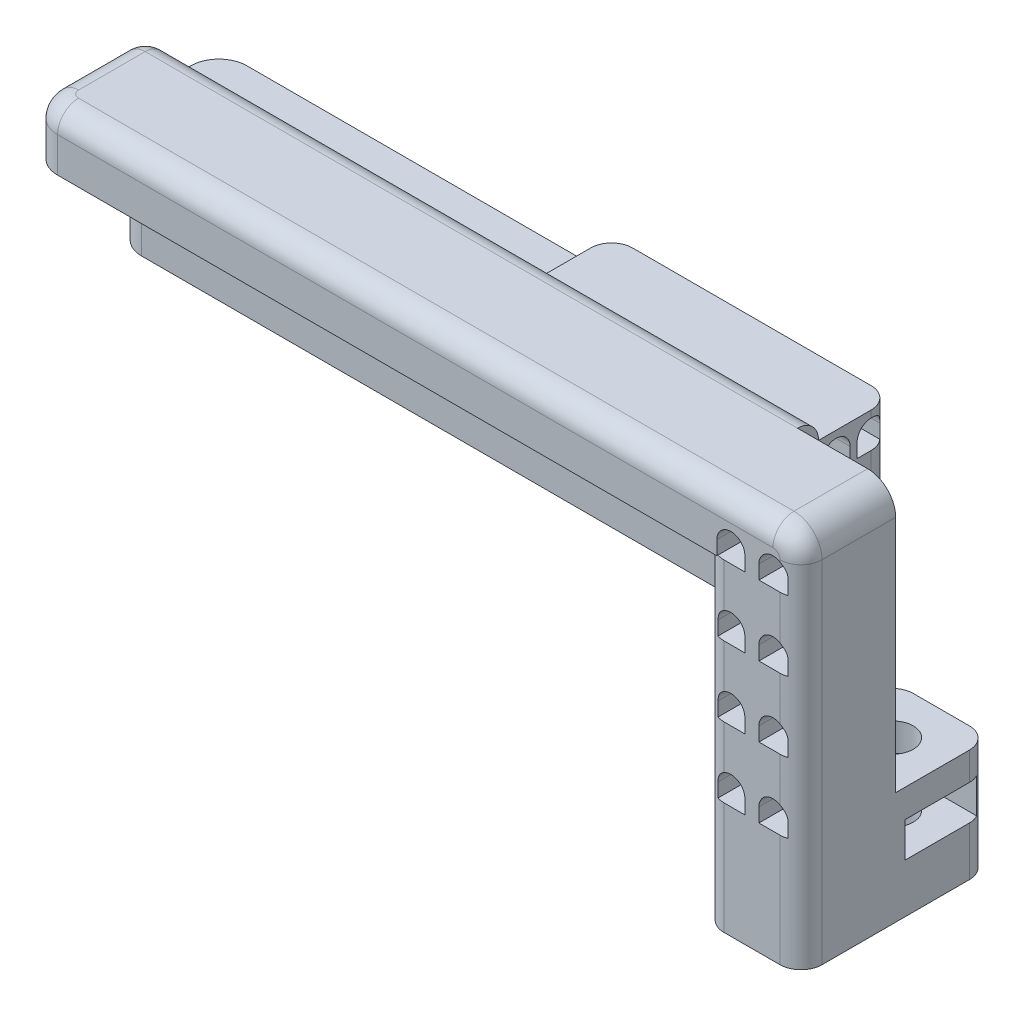
from build123d import *

# Parameters (mm, degrees)
SKETCH1_W            = 55
SKETCH1_H            = 16
BOSS_EXTRUDE1_DEPTH  = 4
SKETCH2_W            = 50
SKETCH2_H            = 8
BOSS_EXTRUDE2_DEPTH  = 8
SKETCH3_W            = 5
SKETCH3_H            = 16
BOSS_EXTRUDE3_DEPTH  = 28
SKETCH4_R            = 1.45
CUT_EXTRUDE2_DEPTH   = 10
CUT_EXTRUDE4_START   = -3
CUT_EXTRUDE4_DEPTH   = 3
CUT_EXTRUDE5_DEPTH   = 5
SKETCH8_W            = 50
SKETCH8_H            = 2
CUT_EXTRUDE6_DEPTH   = 4
CUT_EXTRUDE7_START   = -50
SKETCH9_W            = 0.5
SKETCH9_H            = 8
CUT_EXTRUDE7_DEPTH   = 50
CUT_EXTRUDE8_START   = -55
SKETCH10_W           = 0.5
SKETCH10_H           = 32
CUT_EXTRUDE8_DEPTH   = 55
CUT_EXTRUDE9_DEPTH   = 3
CUT_EXTRUDE11_DEPTH  = 3
BOSS_EXTRUDE4_START  = 2
SKETCH17_W           = 15
SKETCH17_H           = 32
BOSS_EXTRUDE4_DEPTH  = 2
SKETCH18_W           = 7
SKETCH18_H           = 1.5
CUT_EXTRUDE12_DEPTH  = 32
FILLET1_R            = 2
SKETCH19_W           = 13.5
SKETCH19_H           = 32
CUT_EXTRUDE13_DEPTH  = 7
SKETCH20_W           = 7
SKETCH20_H           = 13.5
BOSS_EXTRUDE5_DEPTH  = 32
CUT_EXTRUDE14_DEPTH  = 13.5
FILLET2_R            = 2
CUT_EXTRUDE15_REACH  = 65.285
SKETCH22_W           = 6.75
SKETCH22_H           = 32
LPATTERN1_COUNT      = 4
LPATTERN1_PITCH      = 5
SKETCH23_W           = 5.25
SKETCH23_H           = 4
CUT_EXTRUDE16_DEPTH  = 48
BOSS_EXTRUDE9_START  = -15
SKETCH29_W           = 7
SKETCH29_H           = 6.75
SKETCH29_R           = 1.45
BOSS_EXTRUDE9_DEPTH  = 8
CUT_EXTRUDE19_START  = -2
CUT_EXTRUDE19_DEPTH  = 2.5
BOSS_EXTRUDE11_DEPTH = 20
SKETCH35_W           = 7
SKETCH35_H           = 5
CUT_EXTRUDE20_DEPTH  = 6.75
FILLET3_R            = 1.5


# Read off the part's stored shape, not the designer's step: Cut-Extrude4
with BuildPart() as part:
    # Sketch1 → Boss-Extrude1 (new body)
    with BuildSketch(Plane(origin=(0, 0, 0), x_dir=(1, 0, 0), z_dir=(0, 1, 0))):
        with Locations((27.5, 8)):
            Rectangle(SKETCH1_W, SKETCH1_H)
    extrude(amount=BOSS_EXTRUDE1_DEPTH)

    # Sketch2 → Boss-Extrude2 (add)
    with BuildSketch(Plane.XZ):
        with Locations((25, -10)):
            Rectangle(SKETCH2_W, SKETCH2_H)
    extrude(amount=BOSS_EXTRUDE2_DEPTH)

    # Sketch3 → Boss-Extrude3 (add)
    with BuildSketch(Plane.XZ):
        with Locations((52.5, -8)):
            Rectangle(SKETCH3_W, SKETCH3_H)
    extrude(amount=BOSS_EXTRUDE3_DEPTH)

    # Sketch4 → Cut-Extrude2 (cut)
    with BuildSketch(Plane.XY.offset(-6)):
        with Locations((10, -4)):
            Circle(SKETCH4_R)
        with Locations((20, -4)):
            Circle(SKETCH4_R)
        with Locations((30, -4)):
            Circle(SKETCH4_R)
        with Locations((40, -4)):
            Circle(SKETCH4_R)
    extrude(amount=-CUT_EXTRUDE2_DEPTH, mode=Mode.SUBTRACT)

    # Cut-Extrude4 outline → Cut-Extrude4 (cut)
    with BuildSketch(Plane.ZY.offset(-50).offset(CUT_EXTRUDE4_START)):
        Polygon((-6.598076211, -25.5), (-4, -27), (-1.401923789, -25.5), (-1.401923789, 0), (-6, 0), (-6, -8), (-6.598076211, -8), align=None)
        Polygon((-7.401923789, -25.5), (-7.401923789, -8), (-12.598076211, -8), (-12.598076211, -25.5), (-10, -27), align=None)
    extrude(amount=CUT_EXTRUDE4_DEPTH, mode=Mode.SUBTRACT)

    # Sketch7 → Cut-Extrude5 (cut)
    with BuildSketch(Plane.ZY.offset(-50)):
        with BuildLine():
            Line((-11.45, -12), (-11.45, -24))
            ThreePointArc((-11.45, -24), (-10, -25.45), (-8.55, -24))
            Line((-8.55, -24), (-8.55, -12))
            ThreePointArc((-8.55, -12), (-10, -10.55), (-11.45, -12))
        make_face()
        with BuildLine():
            Line((-2.55, -12), (-2.55, -24))
            ThreePointArc((-2.55, -24), (-4, -25.45), (-5.45, -24))
            Line((-5.45, -24), (-5.45, -12))
            ThreePointArc((-5.45, -12), (-4, -10.55), (-2.55, -12))
        make_face()
    extrude(amount=-CUT_EXTRUDE5_DEPTH, mode=Mode.SUBTRACT)

    # Sketch8 → Cut-Extrude6 (cut)
    with BuildSketch(Plane(origin=(0, 4, 0), x_dir=(1, 0, 0), z_dir=(0, 1, 0))):
        with Locations((25, 15)):
            Rectangle(SKETCH8_W, SKETCH8_H)
    extrude(amount=-CUT_EXTRUDE6_DEPTH, mode=Mode.SUBTRACT)

    # Sketch9 → Cut-Extrude7 (cut)
    with BuildSketch(Plane.ZY.offset(CUT_EXTRUDE7_START)):
        with Locations((-6.25, -4)):
            Rectangle(SKETCH9_W, SKETCH9_H)
    extrude(amount=CUT_EXTRUDE7_DEPTH, mode=Mode.SUBTRACT)

    # Sketch10 → Cut-Extrude8 (cut)
    with BuildSketch(Plane.ZY.offset(CUT_EXTRUDE8_START)):
        with Locations((-0.25, -12)):
            Rectangle(SKETCH10_W, SKETCH10_H)
        with Locations((-15.75, -12)):
            Rectangle(SKETCH10_W, SKETCH10_H)
    extrude(amount=CUT_EXTRUDE8_DEPTH, mode=Mode.SUBTRACT)

    # Sketch11 → Cut-Extrude9 (cut)
    with BuildSketch(Plane(origin=(0, 0, -14), x_dir=(-1, 0, 0), z_dir=(0, 0, -1))):
        Polygon((-37, -4), (-38.5, -1.401923789), (-41.5, -1.401923789), (-43, -4), (-41.5, -6.598076211), (-38.5, -6.598076211), align=None)
        Polygon((-27, -4), (-28.5, -1.401923789), (-31.5, -1.401923789), (-33, -4), (-31.5, -6.598076211), (-28.5, -6.598076211), align=None)
        Polygon((-17, -4), (-18.5, -1.401923789), (-21.5, -1.401923789), (-23, -4), (-21.5, -6.598076211), (-18.5, -6.598076211), align=None)
        Polygon((-7, -4), (-8.5, -1.401923789), (-11.5, -1.401923789), (-13, -4), (-11.5, -6.598076211), (-8.5, -6.598076211), align=None)
    extrude(amount=-CUT_EXTRUDE9_DEPTH, mode=Mode.SUBTRACT)

    # Sketch15 → Cut-Extrude11 (cut)
    with BuildSketch(Plane.ZY.offset(-50)):
        Polygon((-4, -27), (-1.401923789, -25.5), (-1.401923789, 0.004821093), (-1.401923789, 4), (-6.598076211, 4), (-6.598076211, -8), (-6.598076211, -25.5), align=None)
        Polygon((-7.401923789, -25.5), (-7.401923789, -8), (-7.401923789, 4), (-12.598076211, 4), (-12.598076211, -8), (-12.598076211, -25.5), (-10, -27), align=None)
    extrude(amount=-CUT_EXTRUDE11_DEPTH, mode=Mode.SUBTRACT)

    # Sketch17 → Boss-Extrude4 (add)
    with BuildSketch(Plane.ZY.offset(-50).offset(BOSS_EXTRUDE4_START)):
        with Locations((-8, -12)):
            Rectangle(SKETCH17_W, SKETCH17_H)
        with BuildLine():
            Line((-11.45, -12), (-11.45, -24))
            ThreePointArc((-11.45, -24), (-10, -25.45), (-8.55, -24))
            Line((-8.55, -24), (-8.55, -12))
            ThreePointArc((-8.55, -12), (-10, -10.55), (-11.45, -12))
        make_face(mode=Mode.SUBTRACT)
        with BuildLine():
            Line((-5.45, -12), (-5.45, -24))
            ThreePointArc((-5.45, -24), (-4, -25.45), (-2.55, -24))
            Line((-2.55, -24), (-2.55, -12))
            ThreePointArc((-2.55, -12), (-4, -10.55), (-5.45, -12))
        make_face(mode=Mode.SUBTRACT)
    extrude(amount=-BOSS_EXTRUDE4_DEPTH)

    # Sketch18 → Cut-Extrude12 (cut)
    with BuildSketch(Plane(origin=(0, 4, 0), x_dir=(1, 0, 0), z_dir=(0, 1, 0))):
        with Locations((51.5, 14.75)):
            Rectangle(SKETCH18_W, SKETCH18_H)
    extrude(amount=-CUT_EXTRUDE12_DEPTH, mode=Mode.SUBTRACT)

    # Fillet1
    fillet1_edges = [part.edges().sort_by_distance(p)[0] for p in [
        (0, -2, -14),
        (0, -4, -6.5),
        (0, 2, -0.5),
        (55, -12, -0.5),
        (48, -14, -0.5),
        (55, -12, -14),
        (48, -18, -14),
    ]]
    fillet(fillet1_edges, radius=FILLET1_R)

    # Sketch19 → Cut-Extrude13 (cut)
    with BuildSketch(Plane(origin=(55, 0, 0), x_dir=(0, 0, -1), z_dir=(1, 0, 0))):
        with Locations((7.25, -12)):
            Rectangle(SKETCH19_W, SKETCH19_H)
    extrude(amount=-CUT_EXTRUDE13_DEPTH, mode=Mode.SUBTRACT)

    # Sketch20 → Boss-Extrude5 (add)
    with BuildSketch(Plane(origin=(0, 4, 0), x_dir=(1, 0, 0), z_dir=(0, 1, 0))):
        with Locations((51.5, 7.25)):
            Rectangle(SKETCH20_W, SKETCH20_H)
    extrude(amount=-BOSS_EXTRUDE5_DEPTH)

    # Sketch21 → Cut-Extrude14 (cut)
    with BuildSketch(Plane.XY.offset(-0.5)):
        with BuildLine():
            Line((52, 1), (52, 0))
            Line((52, 0), (54, 0))
            Line((54, 0), (54, 1))
            ThreePointArc((54, 1), (53.707106781, 1.707106781), (53, 2))
            ThreePointArc((53, 2), (52.292893219, 1.707106781), (52, 1))
        make_face()
        with BuildLine():
            Line((49, 1), (49, 0))
            Line((49, 0), (51, 0))
            Line((51, 0), (51, 1))
            ThreePointArc((51, 1), (50, 2), (49, 1))
        make_face()
    cut_extrude14 = extrude(amount=-CUT_EXTRUDE14_DEPTH, mode=Mode.SUBTRACT)

    # Fillet2
    fillet2_edges = [part.edges().sort_by_distance(p)[0] for p in [
        (48, -28, -7.25),
        (55, -28, -7.25),
        (55, 4, -7.25),
    ]]
    fillet(fillet2_edges, radius=FILLET2_R)

    # Cut-Extrude15: up to this face of the body (flat: up to its plane)
    cut_extrude15_end = Plane(part.part.faces().sort_by_distance((48, -14.855670103, -6.631443299))[0])
    # Sketch22 → Cut-Extrude15 (cut, up to the picked face)
    with BuildSketch(Plane(origin=(55, 0, 0), x_dir=(0, 0, -1), z_dir=(1, 0, 0)), mode=Mode.PRIVATE) as cut_extrude15_sk1:
        with Locations((10.625, -12)):
            Rectangle(SKETCH22_W, SKETCH22_H)
    cut_extrude15_tool1 = split(extrude(cut_extrude15_sk1.sketch, amount=-CUT_EXTRUDE15_REACH, mode=Mode.PRIVATE), bisect_by=cut_extrude15_end, keep=Keep.BOTH, mode=Mode.PRIVATE)
    add(cut_extrude15_tool1.solids().sort_by(Axis((55, -12, -10.625), (-1, 0, 0)))[0], mode=Mode.SUBTRACT)

    # LPattern1: Cut-Extrude14 ×4
    with Locations(*[(0, -i * LPATTERN1_PITCH, 0) for i in range(1, LPATTERN1_COUNT)]):
        add(cut_extrude14, mode=Mode.SUBTRACT)

    # Sketch23 → Cut-Extrude16 (cut)
    with BuildSketch(Plane(origin=(48, 0, 0), x_dir=(0, 0, -1), z_dir=(1, 0, 0))):
        with Locations((11.375, 2)):
            Rectangle(SKETCH23_W, SKETCH23_H)
    extrude(amount=-CUT_EXTRUDE16_DEPTH, mode=Mode.SUBTRACT)

    # Sketch29 → Boss-Extrude9 (add)
    with BuildSketch(Plane(origin=(0, 0, 0), x_dir=(1, 0, 0), z_dir=(0, 1, 0)).offset(BOSS_EXTRUDE9_START)):
        with Locations((51.5, 10.625)):
            Rectangle(SKETCH29_W, SKETCH29_H)
        with Locations(Location((51.5, 10.55, 0), (0, 0, 270))):
            Circle(SKETCH29_R, mode=Mode.SUBTRACT)
    extrude(amount=-BOSS_EXTRUDE9_DEPTH)

    # Sketch30 → Cut-Extrude19 (cut)
    with BuildSketch(Plane(origin=(0, -15, 0), x_dir=(1, 0, 0), z_dir=(0, 1, 0)).offset(CUT_EXTRUDE19_START)):
        Polygon((53.029978213, 13.2), (49.970021787, 13.2), (48.440043573, 10.55), (49.970021787, 7.9), (53.029978213, 7.9), (55, 7.9), (55, 13.2), align=None)
    extrude(amount=-CUT_EXTRUDE19_DEPTH, mode=Mode.SUBTRACT)

    # Sketch34 → Boss-Extrude11 (add)
    with BuildSketch(Plane(origin=(48, 0, 0), x_dir=(0, 0, -1), z_dir=(1, 0, 0))):
        with BuildLine():
            Line((14, 2.5), (7.25, 2.5))
            Line((7.25, 2.5), (7.25, 0))
            Line((7.25, 0), (9, 0))
            Line((9, 0), (9, 1))
            ThreePointArc((9, 1), (10, 2), (11, 1))
            Line((11, 1), (11, 0))
            Line((11, 0), (11.5, 0))
            Line((11.5, 0), (11.5, 1))
            ThreePointArc((11.5, 1), (12.5, 2), (13.5, 1))
            Line((13.5, 1), (13.5, 0))
            Line((13.5, 0), (14, 0))
            Line((14, 0), (14, 2.5))
        make_face()
    extrude(amount=-BOSS_EXTRUDE11_DEPTH)

    # Sketch35 → Cut-Extrude20 (cut)
    with BuildSketch(Plane.XY.offset(-0.5)):
        with Locations((51.5, -25.5)):
            Rectangle(SKETCH35_W, SKETCH35_H)
    extrude(amount=-CUT_EXTRUDE20_DEPTH, mode=Mode.SUBTRACT)

    # Fillet3
    # the kernel refuses this fillet: 1.5 mm, written as the material it takes off along each edge
    with BuildSketch(Plane(origin=(1.5, 2.5, -7.25), x_dir=(0, 0, -1), z_dir=(0, 1, 0))) as fillet3_piece_1_section:
        Polygon((0, 0), (FILLET3_R, 0), (FILLET3_R, FILLET3_R), (0, FILLET3_R), align=None)
    fillet3_piece_1 = extrude(amount=FILLET3_R, mode=Mode.PRIVATE)
    fillet3_piece_1 = fillet3_piece_1 - Plane(origin=(1.5, 2.5, -7.25), x_dir=(0.7071067811865475, 0, 0.7071067811865475), z_dir=(0, 1, 0)) * Sphere(FILLET3_R, mode=Mode.PRIVATE)
    add(fillet3_piece_1, mode=Mode.SUBTRACT)
    with BuildSketch(Plane(origin=(0, 4, -7.25), x_dir=(1, 0, 0), z_dir=(0, 0, 1))) as fillet3_piece_2:
        with BuildLine():
            CenterArc((FILLET3_R, -FILLET3_R), FILLET3_R, 90, 90)
            Line((0, -FILLET3_R), (0, 0))
            Line((0, 0), (FILLET3_R, 0))
        make_face()
    extrude(amount=4.75, mode=Mode.SUBTRACT)
    with BuildSketch(Plane(origin=(2, 4, -2.5), x_dir=(-1, 0, 0), z_dir=(0, 0, -1))) as fillet3_piece_3:
        with BuildLine():
            CenterArc((2 - FILLET3_R, -FILLET3_R), FILLET3_R, 0, 90)
            Line((2, -FILLET3_R), (2, 0))
            Line((2, 0), (2 - FILLET3_R, 0))
        make_face()
    revolve(axis=Axis((2, 4, -2.5), (0, 1, 0)), revolution_arc=90, mode=Mode.SUBTRACT)
    with BuildSketch(Plane(origin=(2, 4, -0.5), x_dir=(0, 0, -1), z_dir=(1, 0, 0))) as fillet3_piece_4:
        with BuildLine():
            CenterArc((FILLET3_R, -FILLET3_R), FILLET3_R, 90, 90)
            Line((0, -FILLET3_R), (0, 0))
            Line((0, 0), (FILLET3_R, 0))
        make_face()
    extrude(amount=51, mode=Mode.SUBTRACT)
    with BuildSketch(Plane(origin=(53, 2, -0.5), x_dir=(0, 1, 0), z_dir=(-1, 0, 0))) as fillet3_piece_5:
        with BuildLine():
            CenterArc((2 - FILLET3_R, FILLET3_R), FILLET3_R, 270, 90)
            Line((2 - FILLET3_R, 0), (2, 0))
            Line((2, 0), (2, FILLET3_R))
        make_face()
    revolve(axis=Axis((53, 2, -0.5), (0, 0, -1)), revolution_arc=90, mode=Mode.SUBTRACT)
    with BuildSketch(Plane(origin=(48, -11.25, -14), x_dir=(0, 0, 1), z_dir=(0, -1, 0))) as fillet3_piece_6:
        with BuildLine():
            CenterArc((FILLET3_R, -FILLET3_R), FILLET3_R, 90, 90)
            Line((0, -FILLET3_R), (0, 0))
            Line((0, 0), (FILLET3_R, 0))
        make_face()
    extrude(amount=15.5, mode=Mode.SUBTRACT)
    with BuildSketch(Plane(origin=(55, -11.25, -14), x_dir=(0, 0, 1), z_dir=(0, -1, 0))) as fillet3_piece_7:
        with BuildLine():
            CenterArc((FILLET3_R, FILLET3_R), FILLET3_R, 180, 90)
            Line((0, FILLET3_R), (0, 0))
            Line((0, 0), (FILLET3_R, 0))
        make_face()
    extrude(amount=15.5, mode=Mode.SUBTRACT)
    with BuildSketch(Plane(origin=(55, 2, -0.5), x_dir=(0, 0, -1), z_dir=(0, -1, 0))) as fillet3_piece_8:
        with BuildLine():
            CenterArc((FILLET3_R, -FILLET3_R), FILLET3_R, 90, 90)
            Line((0, -FILLET3_R), (0, 0))
            Line((0, 0), (FILLET3_R, 0))
        make_face()
    extrude(amount=28.75, mode=Mode.SUBTRACT)
    with BuildSketch(Plane(origin=(51.75, 4, -8.75), x_dir=(0, 0, 1), z_dir=(-1, 0, 0))) as fillet3_piece_9:
        with BuildLine():
            CenterArc((FILLET3_R, -FILLET3_R), FILLET3_R, 90, 90)
            Line((0, -FILLET3_R), (0, 0))
            Line((0, 0), (FILLET3_R, 0))
        make_face()
    extrude(amount=50.25, mode=Mode.SUBTRACT)
    with BuildSketch(Plane(origin=(0, 0, -8.75), x_dir=(1, 0, 0), z_dir=(0, 1, 0))) as fillet3_piece_10:
        with BuildLine():
            CenterArc((FILLET3_R, -FILLET3_R), FILLET3_R, 90, 90)
            Line((0, -FILLET3_R), (0, 0))
            Line((0, 0), (FILLET3_R, 0))
        make_face()
    extrude(amount=2.5, mode=Mode.SUBTRACT)
    with BuildSketch(Plane(origin=(48, 0, -0.5), x_dir=(0, 0, -1), z_dir=(0, -1, 0))) as fillet3_piece_11:
        with BuildLine():
            CenterArc((FILLET3_R, FILLET3_R), FILLET3_R, 180, 90)
            Line((0, FILLET3_R), (0, 0))
            Line((0, 0), (FILLET3_R, 0))
        make_face()
    extrude(amount=26.75, mode=Mode.SUBTRACT)
    with BuildSketch(Plane(origin=(28, 0, -14), x_dir=(1, 0, 0), z_dir=(0, 1, 0))) as fillet3_piece_12:
        with BuildLine():
            CenterArc((FILLET3_R, -FILLET3_R), FILLET3_R, 90, 90)
            Line((0, -FILLET3_R), (0, 0))
            Line((0, 0), (FILLET3_R, 0))
        make_face()
    extrude(amount=6.25, mode=Mode.SUBTRACT)
    with BuildSketch(Plane(origin=(48, -11.75, -14), x_dir=(-1, 0, 0), z_dir=(0, 1, 0))) as fillet3_piece_13:
        with BuildLine():
            CenterArc((FILLET3_R, FILLET3_R), FILLET3_R, 180, 90)
            Line((0, FILLET3_R), (0, 0))
            Line((0, 0), (FILLET3_R, 0))
        make_face()
    extrude(amount=18, mode=Mode.SUBTRACT)


solid = part.part
